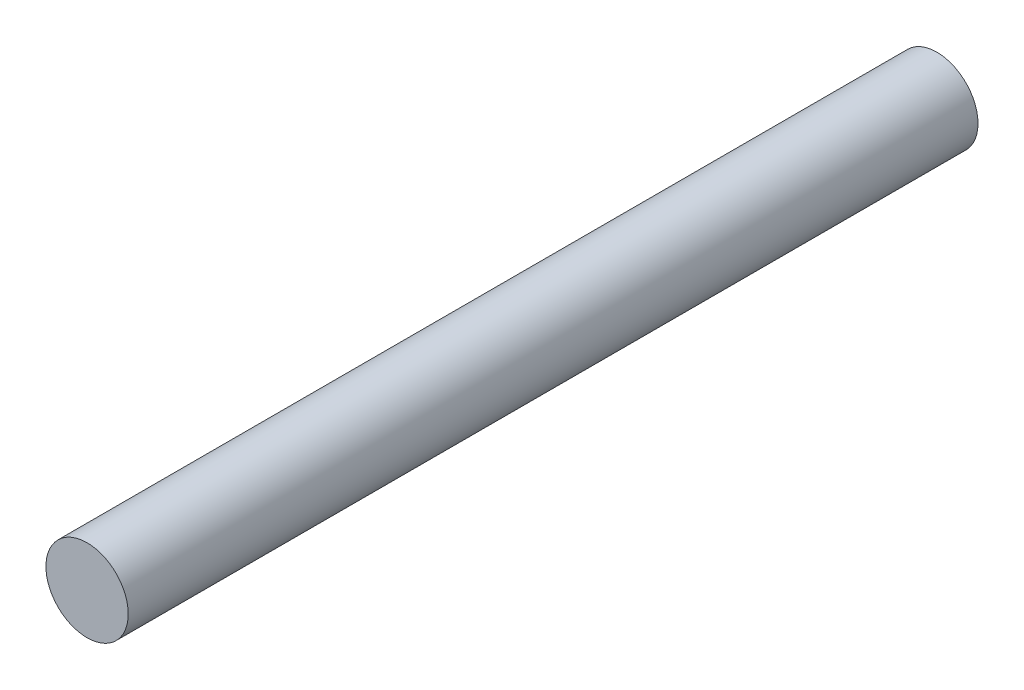
from build123d import *

# Parameters (mm, degrees)
SKETCH2_R           = 3.875
BOSS_EXTRUDE1_DEPTH = 80


with BuildPart() as part:
    # Sketch2 → Boss-Extrude1 (new body)
    with BuildSketch(Plane.XY):
        Circle(SKETCH2_R)
    extrude(amount=BOSS_EXTRUDE1_DEPTH)


solid = part.part
